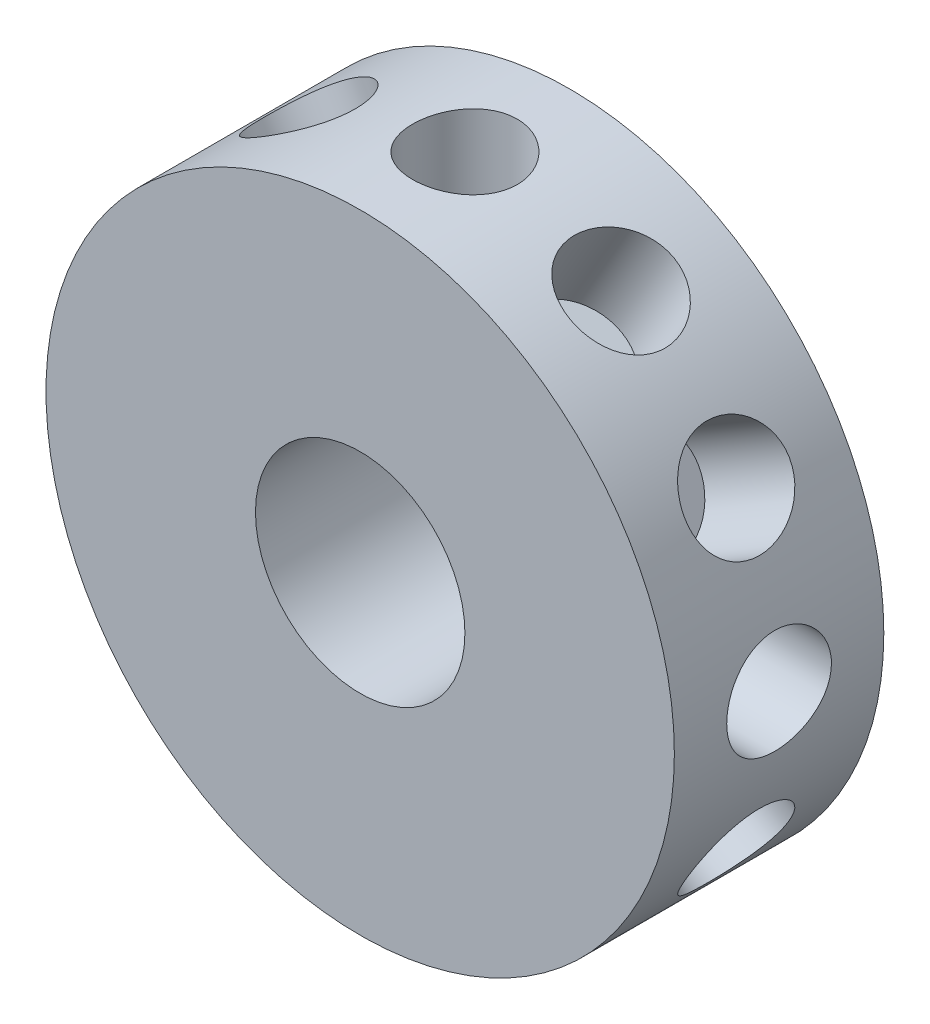
from build123d import *

# Parameters (mm, degrees)
SKETCH1_R           = 6
SKETCH1_R_2         = 2
BOSS_EXTRUDE1_DEPTH = 2
SKETCH3_R           = 1
CUT_EXTRUDE1_DEPTH  = 2
CIRPATTERN1_COUNT   = 12


with BuildPart() as part:
    # Sketch1 → Boss-Extrude1 (new, symmetric)
    with BuildSketch(Plane.XY):
        Circle(SKETCH1_R)
        Circle(SKETCH1_R_2, mode=Mode.SUBTRACT)
    extrude(amount=BOSS_EXTRUDE1_DEPTH, both=True)

    # Sketch3 → Cut-Extrude1 (cut)
    with BuildSketch(Plane(origin=(0, -6, 0), x_dir=(-1, 0, 0), z_dir=(0, -1, 0))):
        Circle(SKETCH3_R)
    cut_extrude1 = extrude(amount=-CUT_EXTRUDE1_DEPTH, mode=Mode.SUBTRACT)

    # CirPattern1: Cut-Extrude1 ×12 about axis
    cirpattern1_axis = Axis((0, 0, -88.99), (0, 0, 1))
    for i in range(1, CIRPATTERN1_COUNT):
        add(cut_extrude1.rotate(cirpattern1_axis, i * 360 / CIRPATTERN1_COUNT), mode=Mode.SUBTRACT)


solid = part.part
